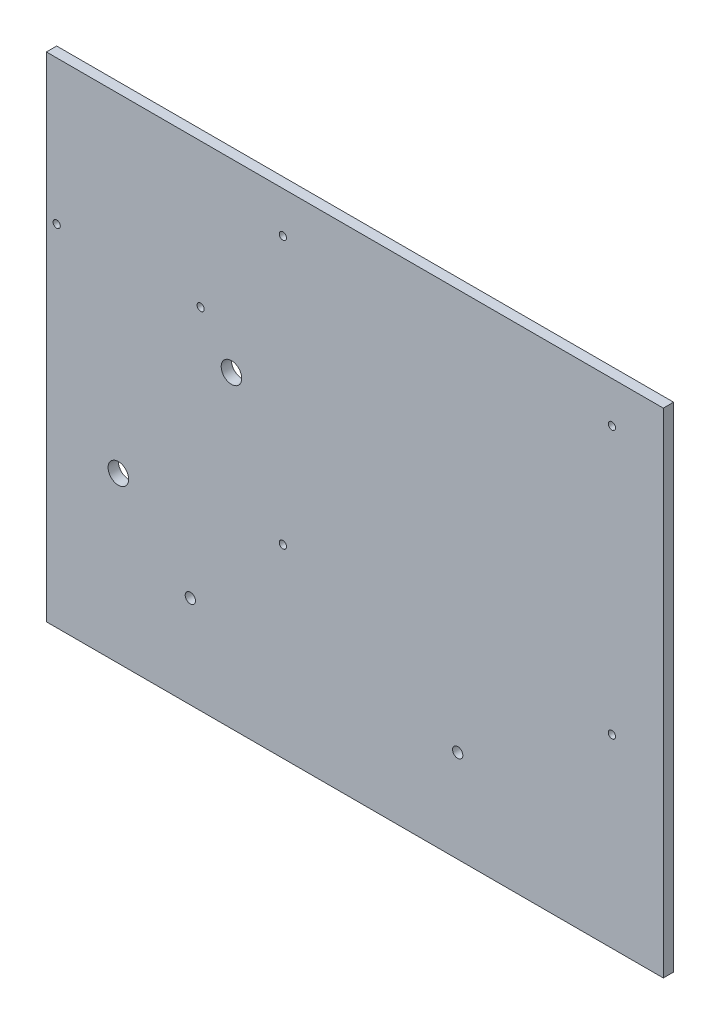
from build123d import *

# Parameters (mm, degrees)
SKETCH1_W             = 381
SKETCH1_H             = 304.8
BOSS_EXTRUDE1_DEPTH   = 6.35
SKETCH2_R             = 2.2225
CUT_EXTRUDE1_DEPTH    = 488.959386117
SKETCH3_R             = 3.175
CUT_EXTRUDE2_DEPTH    = 488.959386117
F_8_CLEARANCE_HOLE1_D = 4.4958
SKETCH6_R             = 6.35
CUT_EXTRUDE3_DEPTH    = 488.959386117
SKETCH7_R             = 6.35
CUT_EXTRUDE4_DEPTH    = 488.959386117


with BuildPart() as part:
    # Sketch1 → Boss-Extrude1 (new body)
    with BuildSketch(Plane.XY):
        with Locations((190.5, 152.4)):
            Rectangle(SKETCH1_W, SKETCH1_H)
    extrude(amount=BOSS_EXTRUDE1_DEPTH)

    # Sketch2 → Cut-Extrude1 (cut, through all)
    with BuildSketch(Plane.XY.offset(6.35)):
        with Locations((6.35, 215.9)):
            Circle(SKETCH2_R)
        with Locations((95.25, 215.9)):
            Circle(SKETCH2_R)
    extrude(amount=-CUT_EXTRUDE1_DEPTH, mode=Mode.SUBTRACT)

    # Sketch3 → Cut-Extrude2 (cut, through all)
    with BuildSketch(Plane.XY.offset(6.35)):
        with Locations((88.9, 57.15)):
            Circle(SKETCH3_R)
        with Locations((254, 57.15)):
            Circle(SKETCH3_R)
    extrude(amount=-CUT_EXTRUDE2_DEPTH, mode=Mode.SUBTRACT)

    # #8 Clearance Hole1 (through all)
    with Locations(Plane.XY.offset(6.35)):
        with Locations((146.05, 114.3), (349.25, 114.3), (146.05, 279.4), (349.25, 279.4)):
            Hole(F_8_CLEARANCE_HOLE1_D / 2)

    # Sketch6 → Cut-Extrude3 (cut, through all)
    with BuildSketch(Plane.XY.offset(6.35)):
        with Locations((114.3, 190.5)):
            Circle(SKETCH6_R)
    extrude(amount=-CUT_EXTRUDE3_DEPTH, mode=Mode.SUBTRACT)

    # Sketch7 → Cut-Extrude4 (cut, through all)
    with BuildSketch(Plane.XY.offset(6.35)):
        with Locations((44.45, 101.6)):
            Circle(SKETCH7_R)
    extrude(amount=-CUT_EXTRUDE4_DEPTH, mode=Mode.SUBTRACT)


solid = part.part
